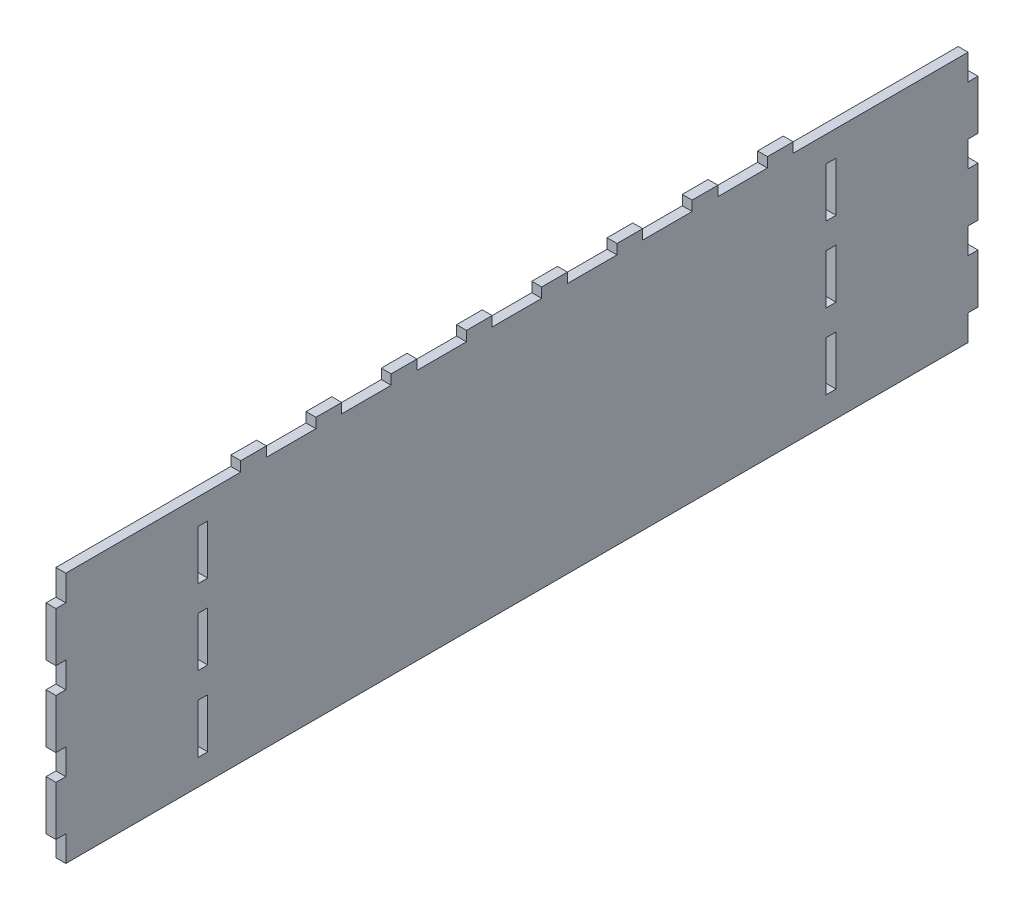
from build123d import *

# Parameters (mm, degrees)
SKETCH1_W               = 279.4
SKETCH1_H               = 76.2
BOSS_EXTRUDE1_DEPTH     = 3
SKETCH3_W               = 3
SKETCH3_H               = 7.8
CUT_EXTRUDE1_DEPTH      = 145.833352512
LPATTERN1_COUNT         = 4
LPATTERN1_PITCH         = 22.8
MIRROR1_COPY_1_SKETCH_W = 3
MIRROR1_COPY_1_SKETCH_H = 7.8
MIRROR1_COPY_1_DEPTH    = 145.833352512
MIRROR1_COPY_2_SKETCH_W = 3
MIRROR1_COPY_2_SKETCH_H = 7.8
MIRROR1_COPY_2_DEPTH    = 145.833352512
MIRROR1_COPY_3_SKETCH_W = 3
MIRROR1_COPY_3_SKETCH_H = 7.8
MIRROR1_COPY_3_DEPTH    = 145.833352512
MIRROR1_COPY_4_SKETCH_W = 3
MIRROR1_COPY_4_SKETCH_H = 7.8
MIRROR1_COPY_4_DEPTH    = 145.833352512
SKETCH4_W               = 3
SKETCH4_H               = 15
CUT_EXTRUDE2_DEPTH      = 10
LPATTERN2_COUNT         = 3
LPATTERN2_PITCH         = 22.8
MIRROR2_COPY_1_SKETCH_W = 3
MIRROR2_COPY_1_SKETCH_H = 15
MIRROR2_COPY_1_DEPTH    = 10
MIRROR2_COPY_2_SKETCH_W = 3
MIRROR2_COPY_2_SKETCH_H = 15
MIRROR2_COPY_2_DEPTH    = 10
MIRROR2_COPY_3_SKETCH_W = 3
MIRROR2_COPY_3_SKETCH_H = 15
MIRROR2_COPY_3_DEPTH    = 10
SKETCH5_W               = 3
SKETCH5_H               = 7.8
BOSS_EXTRUDE2_DEPTH     = 3
LPATTERN3_COUNT         = 8
LPATTERN3_PITCH         = 22.8


with BuildPart() as part:
    # Sketch1 → Boss-Extrude1 (new body)
    with BuildSketch(Plane(origin=(0, 0, 0), x_dir=(0, 0, -1), z_dir=(1, 0, 0))):
        Rectangle(SKETCH1_W, SKETCH1_H)
    extrude(amount=-BOSS_EXTRUDE1_DEPTH)

    # Sketch3 → Cut-Extrude1 (cut, through all)
    with BuildSketch(Plane.ZY.offset(3)):
        with Locations((-138.2, 34.2)):
            Rectangle(SKETCH3_W, SKETCH3_H)
    cut_extrude1 = extrude(amount=-CUT_EXTRUDE1_DEPTH, mode=Mode.SUBTRACT)

    # LPattern1: Cut-Extrude1 ×4
    with Locations(*[(0, -i * LPATTERN1_PITCH, 0) for i in range(1, LPATTERN1_COUNT)]):
        add(cut_extrude1, mode=Mode.SUBTRACT)

    # Mirror1 copy 1 sketch → Mirror1 copy 1 (cut, through all)
    with BuildSketch(Plane(origin=(-3, -22.8, 0), x_dir=(0, 0, -1), z_dir=(-1, 0, 0))):
        with Locations((-138.2, -34.2)):
            Rectangle(MIRROR1_COPY_1_SKETCH_W, MIRROR1_COPY_1_SKETCH_H)
    extrude(amount=-MIRROR1_COPY_1_DEPTH, mode=Mode.SUBTRACT)

    # Mirror1 copy 2 sketch → Mirror1 copy 2 (cut, through all)
    with BuildSketch(Plane(origin=(-3, -45.6, 0), x_dir=(0, 0, -1), z_dir=(-1, 0, 0))):
        with Locations((-138.2, -34.2)):
            Rectangle(MIRROR1_COPY_2_SKETCH_W, MIRROR1_COPY_2_SKETCH_H)
    extrude(amount=-MIRROR1_COPY_2_DEPTH, mode=Mode.SUBTRACT)

    # Mirror1 copy 3 sketch → Mirror1 copy 3 (cut, through all)
    with BuildSketch(Plane(origin=(-3, -68.4, 0), x_dir=(0, 0, -1), z_dir=(-1, 0, 0))):
        with Locations((-138.2, -34.2)):
            Rectangle(MIRROR1_COPY_3_SKETCH_W, MIRROR1_COPY_3_SKETCH_H)
    extrude(amount=-MIRROR1_COPY_3_DEPTH, mode=Mode.SUBTRACT)

    # Mirror1 copy 4 sketch → Mirror1 copy 4 (cut, through all)
    with BuildSketch(Plane(origin=(-3, 0, 0), x_dir=(0, 0, -1), z_dir=(-1, 0, 0))):
        with Locations((-138.2, -34.2)):
            Rectangle(MIRROR1_COPY_4_SKETCH_W, MIRROR1_COPY_4_SKETCH_H)
    extrude(amount=-MIRROR1_COPY_4_DEPTH, mode=Mode.SUBTRACT)

    # Sketch4 → Cut-Extrude2 (cut)
    with BuildSketch(Plane(origin=(0, 0, 0), x_dir=(0, 0, -1), z_dir=(1, 0, 0))):
        with Locations((-95.2, 22.8)):
            Rectangle(SKETCH4_W, SKETCH4_H)
    cut_extrude2 = extrude(amount=-CUT_EXTRUDE2_DEPTH, mode=Mode.SUBTRACT)

    # LPattern2: Cut-Extrude2 ×3
    with Locations(*[(0, -i * LPATTERN2_PITCH, 0) for i in range(1, LPATTERN2_COUNT)]):
        add(cut_extrude2, mode=Mode.SUBTRACT)

    # Mirror2 copy 1 sketch → Mirror2 copy 1 (cut)
    with BuildSketch(Plane(origin=(0, -22.8, 0), x_dir=(0, 0, 1), z_dir=(1, 0, 0))):
        with Locations((-95.2, -22.8)):
            Rectangle(MIRROR2_COPY_1_SKETCH_W, MIRROR2_COPY_1_SKETCH_H)
    extrude(amount=-MIRROR2_COPY_1_DEPTH, mode=Mode.SUBTRACT)

    # Mirror2 copy 2 sketch → Mirror2 copy 2 (cut)
    with BuildSketch(Plane(origin=(0, -45.6, 0), x_dir=(0, 0, 1), z_dir=(1, 0, 0))):
        with Locations((-95.2, -22.8)):
            Rectangle(MIRROR2_COPY_2_SKETCH_W, MIRROR2_COPY_2_SKETCH_H)
    extrude(amount=-MIRROR2_COPY_2_DEPTH, mode=Mode.SUBTRACT)

    # Mirror2 copy 3 sketch → Mirror2 copy 3 (cut)
    with BuildSketch(Plane(origin=(0, 0, 0), x_dir=(0, 0, 1), z_dir=(1, 0, 0))):
        with Locations((-95.2, -22.8)):
            Rectangle(MIRROR2_COPY_3_SKETCH_W, MIRROR2_COPY_3_SKETCH_H)
    extrude(amount=-MIRROR2_COPY_3_DEPTH, mode=Mode.SUBTRACT)

    # Sketch5 → Boss-Extrude2 (add)
    with BuildSketch(Plane(origin=(0, 38.1, 0), x_dir=(1, 0, 0), z_dir=(0, 1, 0))):
        with Locations((-1.5, -79.8)):
            Rectangle(SKETCH5_W, SKETCH5_H)
    boss_extrude2 = extrude(amount=BOSS_EXTRUDE2_DEPTH)

    # LPattern3: Boss-Extrude2 ×8
    with Locations(*[(0, 0, -i * LPATTERN3_PITCH) for i in range(1, LPATTERN3_COUNT)]):
        add(boss_extrude2)


solid = part.part
